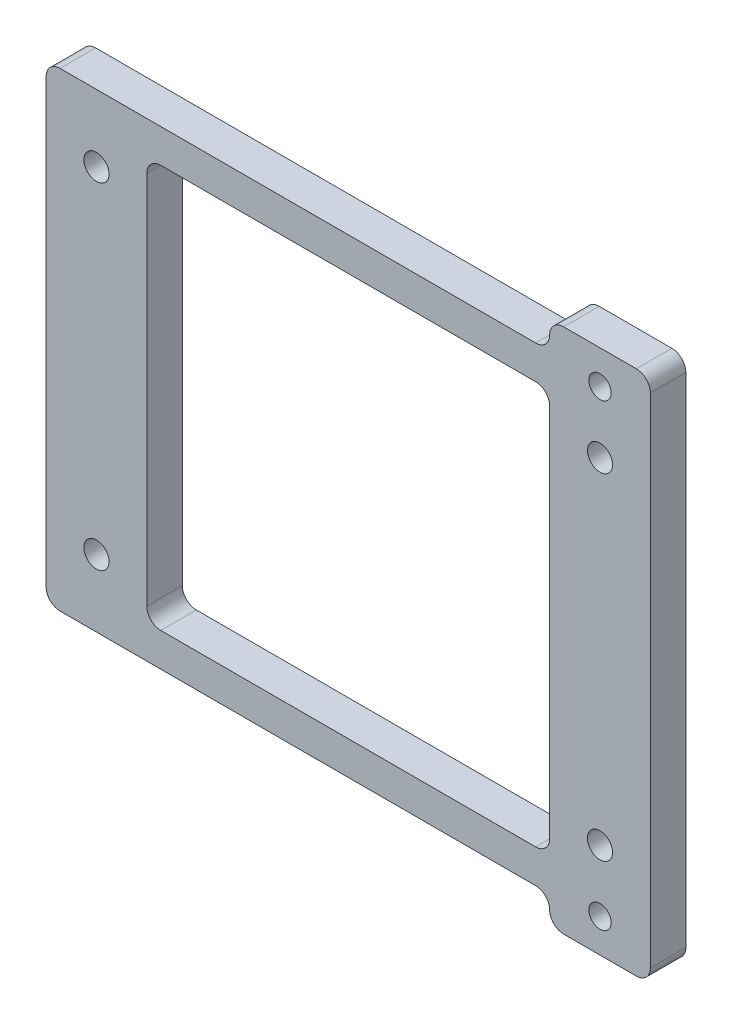
from build123d import *

# Parameters (mm, degrees)
SKETCH1_R           = 2.25
SKETCH1_R_2         = 2
SKETCH1_W           = 72
SKETCH1_H           = 72
BOSS_EXTRUDE1_DEPTH = 6.35
FILLET1_START       = -1
FILLET1_DEPTH       = 8
FILLET1_2_DEPTH     = 6.35


with BuildPart() as part:
    # Sketch1 → Boss-Extrude1 (new body)
    with BuildSketch(Plane.XY):
        Polygon((54.107594743, 42), (54.107594743, 47), (36.107594743, 47), (36.107594743, 42), (-53.892405257, 42), (-53.892405257, -42), (36.107594743, -42), (36.107594743, -47), (54.107594743, -47), (54.107594743, -42), align=None)
        with Locations((-44.892405257, 30)):
            Circle(SKETCH1_R, mode=Mode.SUBTRACT)
        with Locations((45.107594743, 30)):
            Circle(SKETCH1_R, mode=Mode.SUBTRACT)
        with Locations((45.107594743, -30)):
            Circle(SKETCH1_R, mode=Mode.SUBTRACT)
        with Locations((-44.892405257, -30)):
            Circle(SKETCH1_R, mode=Mode.SUBTRACT)
        with Locations((45.107594743, -41)):
            Circle(SKETCH1_R_2, mode=Mode.SUBTRACT)
        with Locations(Location((45.107594743, 41, 0), (0, 0, 180))):
            Circle(SKETCH1_R_2, mode=Mode.SUBTRACT)
        with Locations((0.107594743, 0)):
            Rectangle(SKETCH1_W, SKETCH1_H, mode=Mode.SUBTRACT)
    extrude(amount=BOSS_EXTRUDE1_DEPTH)

    # Fillet1: read off the stored shape, not the designer's step
    # Fillet1 outline → Fillet1 (cut)
    with BuildSketch(Plane.XY.offset(FILLET1_START)):
        with BuildLine():
            Line((36.107594743, 47), (36.107594743, 44.5))
            ThreePointArc((36.107594743, 44.5), (36.83982779, 46.267766953), (38.607594743, 47))
            Line((38.607594743, 47), (36.107594743, 47))
        make_face()
        with BuildLine():
            Line((54.107594743, 47), (51.607594743, 47))
            ThreePointArc((51.607594743, 47), (53.375361696, 46.267766953), (54.107594743, 44.5))
            Line((54.107594743, 44.5), (54.107594743, 47))
        make_face()
        with BuildLine():
            ThreePointArc((-53.892405257, 39.5), (-53.16017221, 41.267766953), (-51.392405257, 42))
            Line((-51.392405257, 42), (-53.892405257, 42))
            Line((-53.892405257, 42), (-53.892405257, 39.5))
        make_face()
        with BuildLine():
            Line((54.107594743, -47), (54.107594743, -44.5))
            ThreePointArc((54.107594743, -44.5), (53.375361696, -46.267766953), (51.607594743, -47))
            Line((51.607594743, -47), (54.107594743, -47))
        make_face()
        with BuildLine():
            ThreePointArc((-51.392405257, -42), (-53.16017221, -41.267766953), (-53.892405257, -39.5))
            Line((-53.892405257, -39.5), (-53.892405257, -42))
            Line((-53.892405257, -42), (-51.392405257, -42))
        make_face()
        with BuildLine():
            Line((36.107594743, -47), (38.607594743, -47))
            ThreePointArc((38.607594743, -47), (36.83982779, -46.267766953), (36.107594743, -44.5))
            Line((36.107594743, -44.5), (36.107594743, -47))
        make_face()
    extrude(amount=FILLET1_DEPTH, mode=Mode.SUBTRACT)

    # Fillet1 2 outline → Fillet1 2 (add)
    with BuildSketch(Plane.XY):
        with BuildLine():
            ThreePointArc((36.107594743, -33.5), (35.375361696, -35.267766953), (33.607594743, -36))
            Line((33.607594743, -36), (36.107594743, -36))
            Line((36.107594743, -36), (36.107594743, -33.5))
        make_face()
        with BuildLine():
            Line((-35.892405257, -36), (-33.392405257, -36))
            ThreePointArc((-33.392405257, -36), (-35.16017221, -35.267766953), (-35.892405257, -33.5))
            Line((-35.892405257, -33.5), (-35.892405257, -36))
        make_face()
        with BuildLine():
            ThreePointArc((33.607594743, 36), (35.375361696, 35.267766953), (36.107594743, 33.5))
            Line((36.107594743, 33.5), (36.107594743, 36))
            Line((36.107594743, 36), (33.607594743, 36))
        make_face()
        with BuildLine():
            Line((-35.892405257, 36), (-35.892405257, 33.5))
            ThreePointArc((-35.892405257, 33.5), (-35.16017221, 35.267766953), (-33.392405257, 36))
            Line((-33.392405257, 36), (-35.892405257, 36))
        make_face()
        with BuildLine():
            Line((36.107594743, 42), (36.107594743, 44.5))
            ThreePointArc((36.107594743, 44.5), (35.375361696, 42.732233047), (33.607594743, 42))
            Line((33.607594743, 42), (36.107594743, 42))
        make_face()
        with BuildLine():
            Line((36.107594743, -42), (33.607594743, -42))
            ThreePointArc((33.607594743, -42), (35.375361696, -42.732233047), (36.107594743, -44.5))
            Line((36.107594743, -44.5), (36.107594743, -42))
        make_face()
    extrude(amount=FILLET1_2_DEPTH)


solid = part.part
